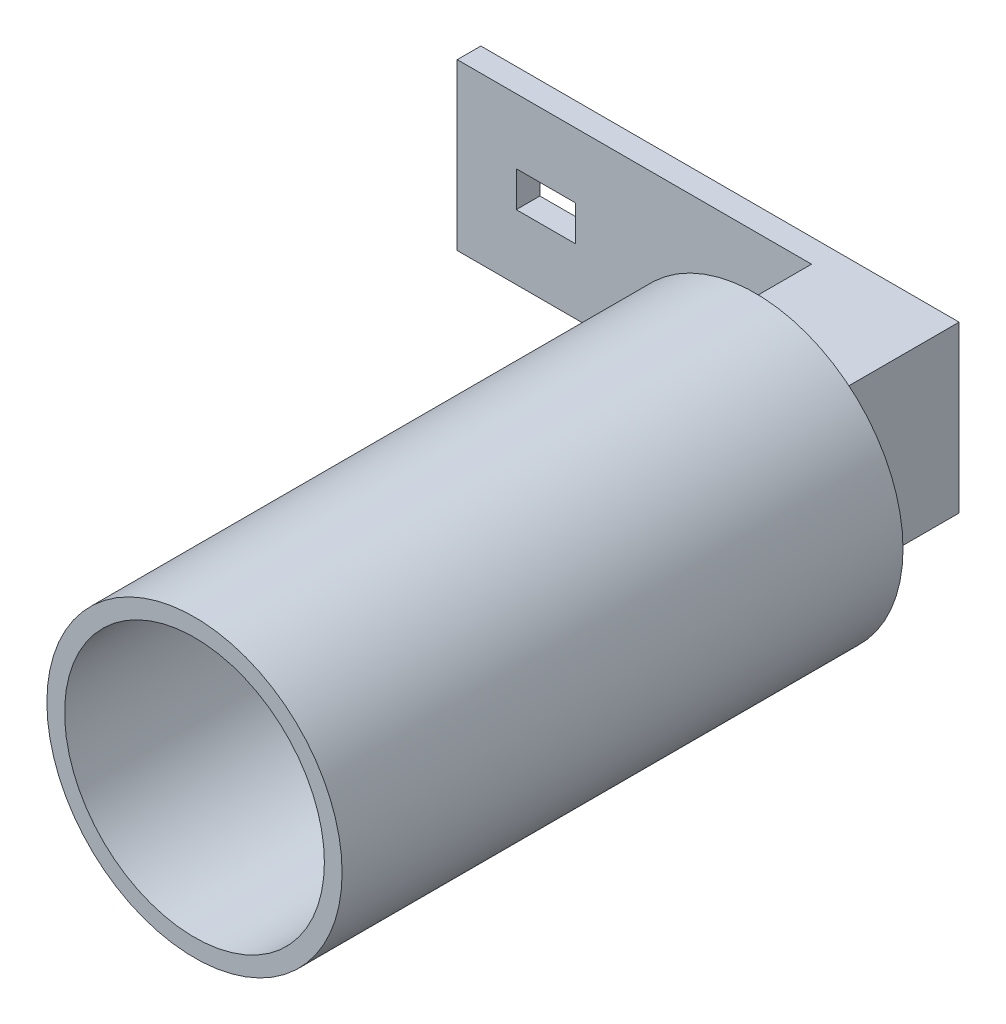
from build123d import *

# Parameters (mm, degrees)
ESQUISSE1_R             = 25
BOSS_EXTRU_1_DEPTH      = 95
ESQUISSE2_R             = 22
ENL_V_MAT_EXTRU_1_DEPTH = 70
ESQUISSE3_W             = 21
ESQUISSE3_H             = 28
BOSS_EXTRU_2_DEPTH      = 24
ESQUISSE4_W             = 4
ESQUISSE4_H             = 28
BOSS_EXTRU_3_DEPTH      = 60
ENL_V_MAT_EXTRU_2_REACH = 142.557
ESQUISSE5_W             = 10
ESQUISSE5_H             = 6


with BuildPart() as part:
    # Esquisse1 → Boss.-Extru.1 (new body)
    with BuildSketch(Plane.XY):
        Circle(ESQUISSE1_R)
    extrude(amount=BOSS_EXTRU_1_DEPTH)

    # Esquisse2 → Enlèv. mat.-Extru.1 (cut)
    with BuildSketch(Plane.XY.offset(95)):
        Circle(ESQUISSE2_R)
    extrude(amount=-ENL_V_MAT_EXTRU_1_DEPTH, mode=Mode.SUBTRACT)

    # Esquisse3 → Boss.-Extru.2 (add)
    with BuildSketch(Plane(origin=(0, 0, 0), x_dir=(-1, 0, 0), z_dir=(0, 0, -1))):
        Rectangle(ESQUISSE3_W, ESQUISSE3_H)
    extrude(amount=BOSS_EXTRU_2_DEPTH)

    # Esquisse4 → Boss.-Extru.3 (add)
    with BuildSketch(Plane.ZY.offset(10.5)):
        with Locations((-22, 0)):
            Rectangle(ESQUISSE4_W, ESQUISSE4_H)
    extrude(amount=BOSS_EXTRU_3_DEPTH)

    # Esquisse5 → Enlèv. mat.-Extru.2 (cut, up to next)
    with BuildSketch(Plane(origin=(0, 0, -24), x_dir=(-1, 0, 0), z_dir=(0, 0, -1)), mode=Mode.PRIVATE) as enl_v_mat_extru_2_sk1:
        with Locations((55.5, 0)):
            Rectangle(ESQUISSE5_W, ESQUISSE5_H)
    enl_v_mat_extru_2_tool1 = extrude(enl_v_mat_extru_2_sk1.sketch, amount=-ENL_V_MAT_EXTRU_2_REACH, mode=Mode.PRIVATE) & part.part
    add(enl_v_mat_extru_2_tool1.solids().sort_by_distance((-55.5, 0, -24))[0], mode=Mode.SUBTRACT)


solid = part.part
